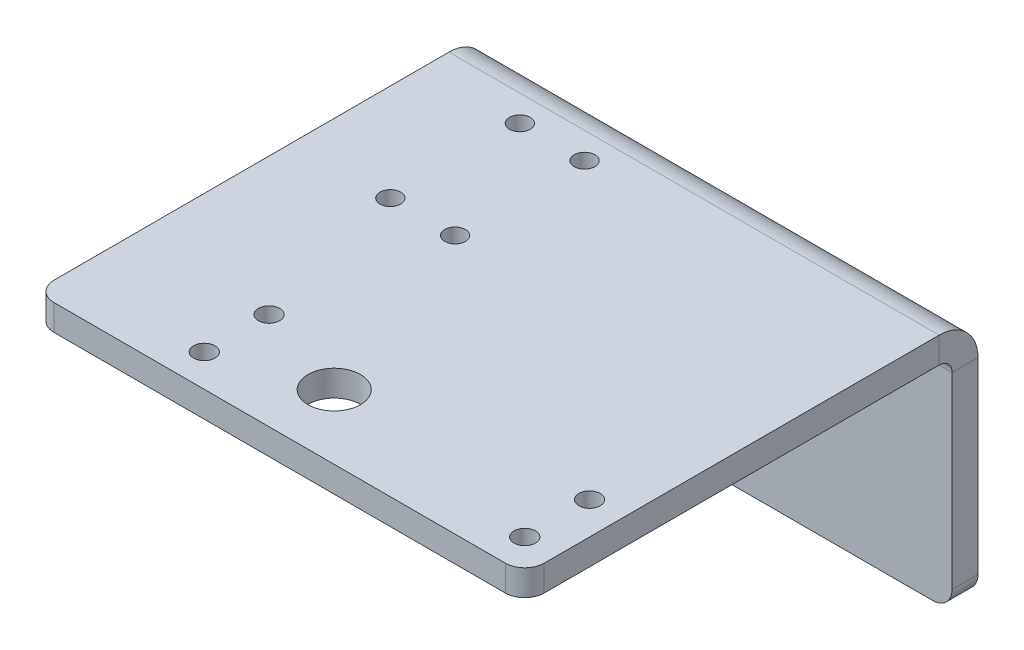
from build123d import *

# Parameters (mm, degrees)
SKETCH_1_W              = 75.71
SKETCH_1_H              = 32
SKETCH_1_R              = 1.6
EXTRUDE_1_DEPTH         = 3
SHEET_START             = -1
SHEET_METAL_1_OUTLINE_W = 75.71
SHEET_METAL_1_OUTLINE_H = 32
SHEET_METAL_1_OUTLINE_R = 1.6
SHEET_METAL_1_DEPTH     = 1
SM_EDGE_FLANGE_1_DEPTH  = 75.71
SKETCH_26_R             = 4.05
SKETCH_26_R_2           = 1.6
CUT_EXTRUDE_1_DEPTH     = 10
FILLET_4_R              = 3
M4X0_7_1_D              = 3.3


# Read off the part's stored shape, not the designer's step: 轉換-實體1
# Sheet-metal steps are written as plain solids
with BuildPart() as part:
    # Sketch 1 → 填料-伸長1 (new body)
    with BuildSketch(Plane.XY):
        with Locations((37.855, -16)):
            Rectangle(SKETCH_1_W, SKETCH_1_H)
        with Locations((36, -5)):
            Circle(SKETCH_1_R, mode=Mode.SUBTRACT)
        with Locations((16, -5)):
            Circle(SKETCH_1_R, mode=Mode.SUBTRACT)
        with Locations((16, -25)):
            Circle(SKETCH_1_R, mode=Mode.SUBTRACT)
        with Locations((36, -25)):
            Circle(SKETCH_1_R, mode=Mode.SUBTRACT)
    extrude(amount=EXTRUDE_1_DEPTH)

    # Sheet Metal 1 outline → Sheet Metal 1 (add)
    with BuildSketch(Plane.XY.offset(SHEET_START)):
        with Locations((37.855, -16)):
            Rectangle(SHEET_METAL_1_OUTLINE_W, SHEET_METAL_1_OUTLINE_H)
        with Locations((16, -25)):
            Circle(SHEET_METAL_1_OUTLINE_R, mode=Mode.SUBTRACT)
        with Locations((36, -25)):
            Circle(SHEET_METAL_1_OUTLINE_R, mode=Mode.SUBTRACT)
        with Locations((16, -5)):
            Circle(SHEET_METAL_1_OUTLINE_R, mode=Mode.SUBTRACT)
        with Locations((36, -5)):
            Circle(SHEET_METAL_1_OUTLINE_R, mode=Mode.SUBTRACT)
    extrude(amount=SHEET_METAL_1_DEPTH)

    # 邊線-凸緣1 section (across the edge) → 邊線-凸緣1 (add)
    with BuildSketch(Plane(origin=(75.71, 2, 3), x_dir=(0, -1, 0), z_dir=(-1, 0, 0))):
        with BuildLine():
            Line((-4, 2), (-4, 66))
            Line((-4, 66), (0, 66))
            Line((0, 66), (0, 2))
            ThreePointArc((0, 2), (0.585786438, 0.585786438), (2, 0))
            Line((2, 0), (2, -4))
            ThreePointArc((2, -4), (-2.242640687, -2.242640687), (-4, 2))
        make_face()
    extrude(amount=SM_EDGE_FLANGE_1_DEPTH)

    # 草圖26 → 除料-伸長1 (cut)
    with BuildSketch(Plane(origin=(0, 6, 0), x_dir=(1, 0, 0), z_dir=(0, 1, 0))):
        with Locations(Location((36.28, -59, 0), (0, 0, 270))):
            Circle(SKETCH_26_R)
        with Locations(Location((15, -9.05, 0), (0, 0, 270))):
            Circle(SKETCH_26_R_2)
        with Locations(Location((25, -9.05, 0), (0, 0, 270))):
            Circle(SKETCH_26_R_2)
        with Locations(Location((15, -29.05, 0), (0, 0, 270))):
            Circle(SKETCH_26_R_2)
        with Locations(Location((25, -29.05, 0), (0, 0, 270))):
            Circle(SKETCH_26_R_2)
    extrude(amount=-CUT_EXTRUDE_1_DEPTH, mode=Mode.SUBTRACT)

    # 圓角4
    fillet_4_edges = [part.edges().sort_by_distance(p)[0] for p in [
        (0, -32, 1),
        (75.71, -32, 1),
        (75.71, 4, 69),
        (0, 4, 69),
    ]]
    fillet(fillet_4_edges, radius=FILLET_4_R)

    # M4x0.7 螺紋孔1 (through all)
    with Locations(Plane(origin=(70.71, 6, 54), x_dir=(0, 0, 1), z_dir=(0, 1, 0))):
        with Locations((0, 0), (10, 0), (10, -49.5), (0, -49.5)):
            Hole(M4X0_7_1_D / 2)


solid = part.part
